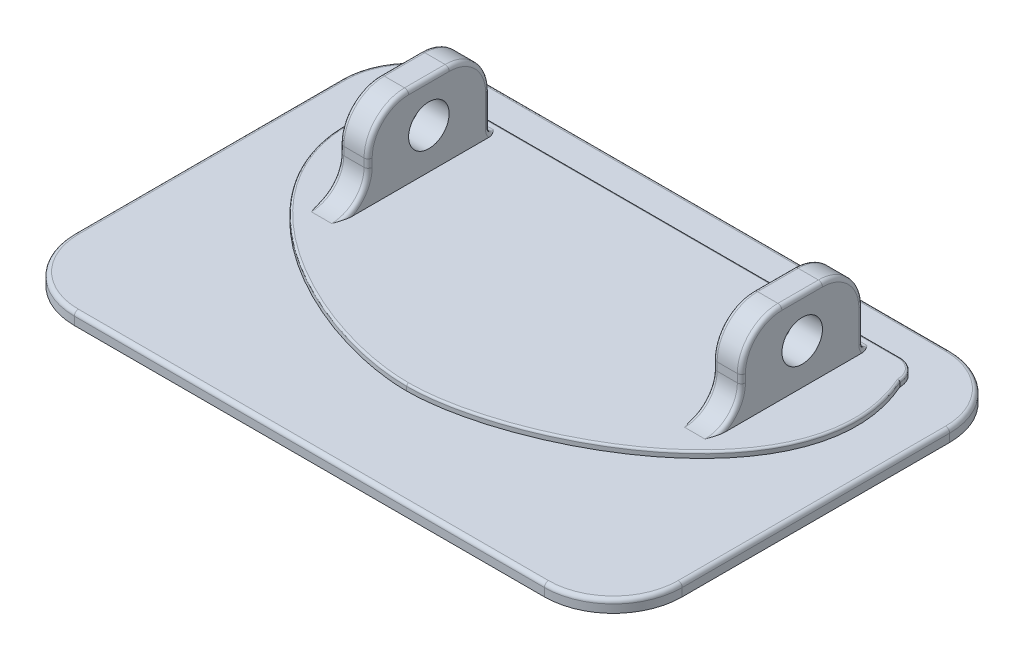
from build123d import *

# Parameters (mm, degrees)
SKETCH1_W               = 190.5
SKETCH1_H               = 127
BOSS_EXTRUDE1_DEPTH     = 7.62
FILLET1_R               = 43.18
FILLET2_R               = 2.54
BOSS_EXTRUDE7_DEPTH     = 3.81
FILLET3_R               = 1.27
SKETCH3_W               = 17.78
SKETCH3_H               = 76.2
BOSS_EXTRUDE8_DEPTH     = 50.8
CUT_EXTRUDE1_DEPTH      = 75.946
CUT_EXTRUDE1_DEPTH_BACK = 303.53
SKETCH4_R               = 12.7
FILLET4_R               = 25.4
FILLET5_R               = 20.32
FILLET6_R               = 5.08
FILLET7_R               = 2.54
SKETCH5_R               = 40
BOSS_EXTRUDE9_DEPTH     = 20


with BuildPart() as part:
    # Sketch1 → Boss-Extrude1 (new body)
    with BuildSketch(Plane(origin=(0, 0, 0), x_dir=(1, 0, 0), z_dir=(0, 1, 0))):
        with Locations((-95.25, 63.5)):
            Rectangle(SKETCH1_W, SKETCH1_H)
        with Locations((-95.25, -63.5)):
            Rectangle(SKETCH1_W, SKETCH1_H)
        with Locations((95.25, -63.5)):
            Rectangle(SKETCH1_W, SKETCH1_H)
        with Locations((95.25, 63.5)):
            Rectangle(SKETCH1_W, SKETCH1_H)
    extrude(amount=BOSS_EXTRUDE1_DEPTH)

    # Fillet1
    fillet1_edges = [part.edges().sort_by_distance(p)[0] for p in [
        (190.5, 3.81, -127),
        (190.5, 3.81, 127),
        (-190.5, 3.81, 127),
        (-190.5, 3.81, -127),
    ]]
    fillet(fillet1_edges, radius=FILLET1_R)

    # Fillet2
    fillet2_edges = [part.edges().sort_by_distance(p)[0] for p in [
        (-190.5, 7.62, 0),
        (0, 7.62, -127),
        (0, 7.62, 127),
        (190.5, 7.62, 0),
        (-177.852870812, 7.62, 114.352870812),
        (177.852870812, 7.62, 114.352870812),
        (177.852870812, 7.62, -114.352870812),
        (-177.852870812, 7.62, -114.352870812),
    ]]
    fillet(fillet2_edges, radius=FILLET2_R)

    # Boss-Extrude7: read off the stored shape, not the designer's step
    # Boss-Extrude7 outline → Boss-Extrude7 (add)
    with BuildSketch(Plane(origin=(0, 7.62, 0), x_dir=(1, 0, 0), z_dir=(0, 1, 0))):
        with BuildLine():
            add(Edge.make_bspline(
                [(152.4, 90.742820972), (192.421496029, 0.246614853), (67.037564927, -66.015914753), (0.035402358, -66.039993442)],
                knots=[0, 0, 0, 0, 0.861976712, 0.861976712, 0.861976712, 0.861976712], degree=3))
            ThreePointArc((152.4, 90.742820972), (148.680256121, 99.723077093), (139.7, 103.442820972))
            Line((139.7, 103.442820972), (-139.7, 103.442820972))
            ThreePointArc((-139.7, 103.442820972), (-148.680256121, 99.723077093), (-152.4, 90.742820972))
            add(Edge.make_bspline(
                [(-152.4, 90.742820972), (-192.428546796, 0.231099908), (-66.971286312, -66.051652702), (0.023603383, -66.039997951), (0.035402358, -66.039993442)],
                knots=[0, 0, 0, 0, 0.862128551, 0.862280437, 0.862280437, 0.862280437, 0.862280437], degree=3))
        make_face()
    extrude(amount=BOSS_EXTRUDE7_DEPTH)

    # Fillet3
    fillet3_edges = [part.edges().sort_by_distance(p)[0] for p in [
        (116.912058042, 11.43, 21.123611422),
        (0, 11.43, -103.442820972),
        (148.680256121, 11.43, -99.723077093),
        (-148.680256121, 11.43, -99.723077093),
        (-116.884695986, 11.43, 21.145875685),
    ]]
    fillet(fillet3_edges, radius=FILLET3_R)

    # Sketch3 → Boss-Extrude8 (add)
    with BuildSketch(Plane(origin=(0, 11.43, 0), x_dir=(1, 0, 0), z_dir=(0, 1, 0))):
        with Locations((116.997822191, 56.001627812)):
            Rectangle(SKETCH3_W, SKETCH3_H)
        with Locations((-116.997822191, 56.001627812)):
            Rectangle(SKETCH3_W, SKETCH3_H)
    extrude(amount=BOSS_EXTRUDE8_DEPTH)

    # Sketch4 → Cut-Extrude1 (cut, two sides: drawn at the far end of the back side and taken through both)
    with BuildSketch(Plane.ZY.offset(125.887822191).offset(-CUT_EXTRUDE1_DEPTH_BACK)):
        with Locations(Location((-56.001627812, 36.83, 0), (0, 0, 180))):
            Circle(SKETCH4_R)
    extrude(amount=CUT_EXTRUDE1_DEPTH + CUT_EXTRUDE1_DEPTH_BACK, mode=Mode.SUBTRACT)

    # Fillet4
    fillet4_edges = [part.edges().sort_by_distance(p)[0] for p in [
        (-116.997822191, 62.23, -94.101627812),
        (-116.997822191, 62.23, -17.901627812),
        (116.997822191, 62.23, -94.101627812),
        (116.997822191, 62.23, -17.901627812),
    ]]
    fillet(fillet4_edges, radius=FILLET4_R)

    # Fillet5
    fillet5_edges = [part.edges().sort_by_distance(p)[0] for p in [
        (-116.997822191, 11.43, -17.901627812),
        (116.997822191, 11.43, -17.901627812),
    ]]
    fillet(fillet5_edges, radius=FILLET5_R)

    # Fillet6
    fillet6_edges = [part.edges().sort_by_distance(p)[0] for p in [
        (-116.997822191, 11.43, -94.101627812),
        (116.997822191, 11.43, -94.101627812),
    ]]
    fillet(fillet6_edges, radius=FILLET6_R)

    # Fillet7
    # the kernel refuses this fillet: 2.54 mm, written as the material it takes off along each edge
    with BuildSketch(Plane(origin=(125.887822191, 62.23, -43.301627812), x_dir=(0, -1, 0), z_dir=(0, 0, -1)), Plane(origin=(108.107822191, 62.23, -68.701627812), x_dir=(0, -1, 0), z_dir=(0, 0, 1))) as fillet7_piece_1:
        with BuildLine():
            CenterArc((FILLET7_R, FILLET7_R), FILLET7_R, 180, 90)
            Line((0, FILLET7_R), (0, 0))
            Line((0, 0), (FILLET7_R, 0))
        make_face()
    extrude(amount=25.4, mode=Mode.SUBTRACT)
    with BuildSketch(Plane(origin=(108.107822191, 31.75, -17.901627812), x_dir=(0, 0, -1), z_dir=(0, 1, 0)), Plane(origin=(-108.107822191, 31.75, -17.901627812), x_dir=(-1, 0, 0), z_dir=(0, 1, 0))) as fillet7_piece_2:
        with BuildLine():
            CenterArc((FILLET7_R, -FILLET7_R), FILLET7_R, 90, 90)
            Line((0, -FILLET7_R), (0, 0))
            Line((0, 0), (FILLET7_R, 0))
        make_face()
    extrude(amount=5.08, mode=Mode.SUBTRACT)
    with BuildSketch(Plane(origin=(108.107822191, 16.51, -94.101627812), x_dir=(0, 0, 1), z_dir=(0, 1, 0)), Plane(origin=(-108.107822191, 16.51, -94.101627812), x_dir=(-1, 0, 0), z_dir=(0, 1, 0))) as fillet7_piece_3:
        with BuildLine():
            CenterArc((FILLET7_R, FILLET7_R), FILLET7_R, 180, 90)
            Line((0, FILLET7_R), (0, 0))
            Line((0, 0), (FILLET7_R, 0))
        make_face()
    extrude(amount=20.32, mode=Mode.SUBTRACT)
    with BuildSketch(Plane(origin=(108.107822191, 36.83, -43.301627812), x_dir=(0, 0, 1), z_dir=(0, -1, 0))) as fillet7_piece_4:
        with BuildLine():
            CenterArc((25.4 - FILLET7_R, -FILLET7_R), FILLET7_R, 0, 90)
            Line((25.4, -FILLET7_R), (25.4, 0))
            Line((25.4, 0), (25.4 - FILLET7_R, 0))
        make_face()
    revolve(axis=Axis((108.107822191, 36.83, -43.301627812), (-1, 0, 0)), revolution_arc=90, mode=Mode.SUBTRACT)
    with BuildSketch(Plane(origin=(108.107822191, 36.83, -68.701627812), x_dir=(0, 0, -1), z_dir=(0, -1, 0))) as fillet7_piece_5:
        with BuildLine():
            CenterArc((25.4 - FILLET7_R, FILLET7_R), FILLET7_R, 270, 90)
            Line((25.4, FILLET7_R), (25.4, 0))
            Line((25.4, 0), (25.4 - FILLET7_R, 0))
        make_face()
    revolve(axis=Axis((108.107822191, 36.83, -68.701627812), (1, 0, 0)), revolution_arc=90, mode=Mode.SUBTRACT)
    with BuildSketch(Plane(origin=(125.887822191, 16.51, -94.101627812), x_dir=(0, 0, 1), z_dir=(0, 1, 0)), Plane(origin=(-125.887822191, 16.51, -94.101627812), x_dir=(1, 0, 0), z_dir=(0, 1, 0))) as fillet7_piece_6:
        with BuildLine():
            CenterArc((FILLET7_R, -FILLET7_R), FILLET7_R, 90, 90)
            Line((0, -FILLET7_R), (0, 0))
            Line((0, 0), (FILLET7_R, 0))
        make_face()
    extrude(amount=20.32, mode=Mode.SUBTRACT)
    with BuildSketch(Plane(origin=(125.887822191, 31.75, -17.901627812), x_dir=(0, 0, -1), z_dir=(0, 1, 0)), Plane(origin=(-125.887822191, 31.75, -17.901627812), x_dir=(1, 0, 0), z_dir=(0, 1, 0))) as fillet7_piece_7:
        with BuildLine():
            CenterArc((FILLET7_R, FILLET7_R), FILLET7_R, 180, 90)
            Line((0, FILLET7_R), (0, 0))
            Line((0, 0), (FILLET7_R, 0))
        make_face()
    extrude(amount=5.08, mode=Mode.SUBTRACT)
    with BuildSketch(Plane(origin=(125.887822191, 36.83, -43.301627812), x_dir=(0, 0, 1), z_dir=(0, -1, 0))) as fillet7_piece_8:
        with BuildLine():
            CenterArc((25.4 - FILLET7_R, FILLET7_R), FILLET7_R, 270, 90)
            Line((25.4, FILLET7_R), (25.4, 0))
            Line((25.4, 0), (25.4 - FILLET7_R, 0))
        make_face()
    revolve(axis=Axis((125.887822191, 36.83, -43.301627812), (-1, 0, 0)), revolution_arc=90, mode=Mode.SUBTRACT)
    with BuildSketch(Plane(origin=(125.887822191, 36.83, -68.701627812), x_dir=(0, 0, -1), z_dir=(0, -1, 0))) as fillet7_piece_9:
        with BuildLine():
            CenterArc((25.4 - FILLET7_R, -FILLET7_R), FILLET7_R, 0, 90)
            Line((25.4, -FILLET7_R), (25.4, 0))
            Line((25.4, 0), (25.4 - FILLET7_R, 0))
        make_face()
    revolve(axis=Axis((125.887822191, 36.83, -68.701627812), (1, 0, 0)), revolution_arc=90, mode=Mode.SUBTRACT)
    with BuildSketch(Plane(origin=(-108.107822191, 62.23, -43.301627812), x_dir=(-1, 0, 0), z_dir=(0, 0, -1)), Plane(origin=(-125.887822191, 62.23, -68.701627812), x_dir=(1, 0, 0), z_dir=(0, 0, 1))) as fillet7_piece_10:
        with BuildLine():
            CenterArc((FILLET7_R, -FILLET7_R), FILLET7_R, 90, 90)
            Line((0, -FILLET7_R), (0, 0))
            Line((0, 0), (FILLET7_R, 0))
        make_face()
    extrude(amount=25.4, mode=Mode.SUBTRACT)
    with BuildSketch(Plane(origin=(-125.887822191, 36.83, -43.301627812), x_dir=(0, 0, 1), z_dir=(0, -1, 0))) as fillet7_piece_11:
        with BuildLine():
            CenterArc((25.4 - FILLET7_R, -FILLET7_R), FILLET7_R, 0, 90)
            Line((25.4 - FILLET7_R, 0), (25.4, 0))
            Line((25.4, 0), (25.4, -FILLET7_R))
        make_face()
    revolve(axis=Axis((-125.887822191, 36.83, -43.301627812), (-1, 0, 0)), revolution_arc=90, mode=Mode.SUBTRACT)
    with BuildSketch(Plane(origin=(-125.887822191, 36.83, -68.701627812), x_dir=(0, 0, -1), z_dir=(0, -1, 0))) as fillet7_piece_12:
        with BuildLine():
            CenterArc((25.4 - FILLET7_R, FILLET7_R), FILLET7_R, 270, 90)
            Line((25.4 - FILLET7_R, 0), (25.4, 0))
            Line((25.4, 0), (25.4, FILLET7_R))
        make_face()
    revolve(axis=Axis((-125.887822191, 36.83, -68.701627812), (1, 0, 0)), revolution_arc=90, mode=Mode.SUBTRACT)
    with BuildSketch(Plane(origin=(-108.107822191, 36.83, -43.301627812), x_dir=(0, 0, 1), z_dir=(0, -1, 0))) as fillet7_piece_13:
        with BuildLine():
            CenterArc((25.4 - FILLET7_R, FILLET7_R), FILLET7_R, 270, 90)
            Line((25.4 - FILLET7_R, 0), (25.4, 0))
            Line((25.4, 0), (25.4, FILLET7_R))
        make_face()
    revolve(axis=Axis((-108.107822191, 36.83, -43.301627812), (-1, 0, 0)), revolution_arc=90, mode=Mode.SUBTRACT)
    with BuildSketch(Plane(origin=(-108.107822191, 36.83, -68.701627812), x_dir=(0, 0, -1), z_dir=(0, -1, 0))) as fillet7_piece_14:
        with BuildLine():
            CenterArc((25.4 - FILLET7_R, -FILLET7_R), FILLET7_R, 0, 90)
            Line((25.4 - FILLET7_R, 0), (25.4, 0))
            Line((25.4, 0), (25.4, -FILLET7_R))
        make_face()
    revolve(axis=Axis((-108.107822191, 36.83, -68.701627812), (1, 0, 0)), revolution_arc=90, mode=Mode.SUBTRACT)
    with BuildSketch(Plane(origin=(125.887822191, 31.75, 2.418372188), x_dir=(0, 0, -1), z_dir=(0, 1, 0))) as fillet7_piece_15_section:
        with BuildLine():
            CenterArc((20.32 + FILLET7_R, FILLET7_R), FILLET7_R, 180, 90)
            Line((20.32, FILLET7_R), (20.32, 0))
            Line((20.32, 0), (20.32 + FILLET7_R, 0))
        make_face()
    fillet7_piece_15 = revolve(axis=Axis((125.887822191, 31.75, 2.418372188), (-1, 0, 0)), revolution_arc=120.450610213, mode=Mode.PRIVATE)
    fillet7_piece_15 = split(fillet7_piece_15, bisect_by=Plane(origin=(125.887822191, 11.43, 2.418372188), z_dir=(0, 1, 0)), keep=Keep.TOP, mode=Mode.PRIVATE)
    add(fillet7_piece_15, mode=Mode.SUBTRACT)
    with BuildSketch(Plane(origin=(108.107822191, 31.75, 2.418372188), x_dir=(0, 0, -1), z_dir=(0, 1, 0))) as fillet7_piece_16_section:
        with BuildLine():
            CenterArc((20.32 + FILLET7_R, -FILLET7_R), FILLET7_R, 90, 90)
            Line((20.32, -FILLET7_R), (20.32, 0))
            Line((20.32, 0), (20.32 + FILLET7_R, 0))
        make_face()
    fillet7_piece_16 = revolve(axis=Axis((108.107822191, 31.75, 2.418372188), (-1, 0, 0)), revolution_arc=120.450610213, mode=Mode.PRIVATE)
    fillet7_piece_16 = split(fillet7_piece_16, bisect_by=Plane(origin=(108.107822191, 11.43, 2.418372188), z_dir=(0, 1, 0)), keep=Keep.TOP, mode=Mode.PRIVATE)
    add(fillet7_piece_16, mode=Mode.SUBTRACT)
    with BuildSketch(Plane(origin=(-108.107822191, 31.75, 2.418372188), x_dir=(0, -0.8620663456403814, 0.506795437740158), z_dir=(0, 0.506795437740158, 0.8620663456403814))) as fillet7_piece_17_section:
        with BuildLine():
            CenterArc((20.32 + FILLET7_R, -FILLET7_R), FILLET7_R, 90, 90)
            Line((20.32 + FILLET7_R, 0), (20.32, 0))
            Line((20.32, 0), (20.32, -FILLET7_R))
        make_face()
    fillet7_piece_17 = revolve(axis=Axis((-108.107822191, 31.75, 2.418372188), (1, 0, 0)), revolution_arc=120.450610213, mode=Mode.PRIVATE)
    fillet7_piece_17 = split(fillet7_piece_17, bisect_by=Plane(origin=(-108.107822191, 11.43, 2.418372188), z_dir=(0, 1, 0)), keep=Keep.TOP, mode=Mode.PRIVATE)
    add(fillet7_piece_17, mode=Mode.SUBTRACT)
    with BuildSketch(Plane(origin=(-125.887822191, 31.75, 2.418372188), x_dir=(0, -0.8620663456403814, 0.5067954377401582), z_dir=(0, 0.5067954377401582, 0.8620663456403814))) as fillet7_piece_18_section:
        with BuildLine():
            CenterArc((20.32 + FILLET7_R, FILLET7_R), FILLET7_R, 180, 90)
            Line((20.32 + FILLET7_R, 0), (20.32, 0))
            Line((20.32, 0), (20.32, FILLET7_R))
        make_face()
    fillet7_piece_18 = revolve(axis=Axis((-125.887822191, 31.75, 2.418372188), (1, 0, 0)), revolution_arc=120.450610213, mode=Mode.PRIVATE)
    fillet7_piece_18 = split(fillet7_piece_18, bisect_by=Plane(origin=(-125.887822191, 11.43, 2.418372188), z_dir=(0, 1, 0)), keep=Keep.TOP, mode=Mode.PRIVATE)
    add(fillet7_piece_18, mode=Mode.SUBTRACT)
    with BuildSketch(Plane(origin=(-125.887822191, 16.51, -99.181627812), x_dir=(0, -0.3148458040869758, -0.9491428341660835), z_dir=(0, 0.9491428341660835, -0.3148458040869758))) as fillet7_piece_19_section:
        with BuildLine():
            CenterArc((5.08 + FILLET7_R, -FILLET7_R), FILLET7_R, 90, 90)
            Line((5.08, -FILLET7_R), (5.08, 0))
            Line((5.08, 0), (5.08 + FILLET7_R, 0))
        make_face()
    fillet7_piece_19 = revolve(axis=Axis((-125.887822191, 16.51, -99.181627812), (-1, 0, 0)), revolution_arc=161.648494619, mode=Mode.PRIVATE)
    fillet7_piece_19 = split(fillet7_piece_19, bisect_by=Plane(origin=(-125.887822191, 11.43, -99.181627812), z_dir=(0, 1, 0)), keep=Keep.TOP, mode=Mode.PRIVATE)
    add(fillet7_piece_19, mode=Mode.SUBTRACT)
    with BuildSketch(Plane(origin=(-108.107822191, 16.51, -99.181627812), x_dir=(0, -0.3148458040869758, -0.9491428341660835), z_dir=(0, 0.9491428341660835, -0.3148458040869758))) as fillet7_piece_20_section:
        with BuildLine():
            CenterArc((5.08 + FILLET7_R, FILLET7_R), FILLET7_R, 180, 90)
            Line((5.08 + FILLET7_R, 0), (5.08, 0))
            Line((5.08, 0), (5.08, FILLET7_R))
        make_face()
    fillet7_piece_20 = revolve(axis=Axis((-108.107822191, 16.51, -99.181627812), (-1, 0, 0)), revolution_arc=161.648494619, mode=Mode.PRIVATE)
    fillet7_piece_20 = split(fillet7_piece_20, bisect_by=Plane(origin=(-108.107822191, 11.43, -99.181627812), z_dir=(0, 1, 0)), keep=Keep.TOP, mode=Mode.PRIVATE)
    add(fillet7_piece_20, mode=Mode.SUBTRACT)
    with BuildSketch(Plane(origin=(108.107822191, 16.51, -99.181627812), x_dir=(2.797412345512208e-15, -0.3148458040869749, -0.9491428341660838), z_dir=(1.0065754734692808e-15, 0.9491428341660838, -0.3148458040869749))) as fillet7_piece_21_section:
        with BuildLine():
            CenterArc((5.08 + FILLET7_R, -FILLET7_R), FILLET7_R, 90, 90)
            Line((5.08, -FILLET7_R), (5.08, 0))
            Line((5.08, 0), (5.08 + FILLET7_R, 0))
        make_face()
    fillet7_piece_21 = revolve(axis=Axis((108.107822191, 16.51, -99.181627812), (-1, 0, 0)), revolution_arc=161.648494619, mode=Mode.PRIVATE)
    fillet7_piece_21 = split(fillet7_piece_21, bisect_by=Plane(origin=(108.107822191, 11.43, -99.181627812), z_dir=(0, 1, 0)), keep=Keep.TOP, mode=Mode.PRIVATE)
    add(fillet7_piece_21, mode=Mode.SUBTRACT)
    with BuildSketch(Plane(origin=(125.887822191, 16.51, -99.181627812), x_dir=(2.7974123455122068e-15, -0.3148458040869758, -0.9491428341660835), z_dir=(1.0065754734692838e-15, 0.9491428341660835, -0.3148458040869758))) as fillet7_piece_22_section:
        with BuildLine():
            CenterArc((5.08 + FILLET7_R, FILLET7_R), FILLET7_R, 180, 90)
            Line((5.08, FILLET7_R), (5.08, 0))
            Line((5.08, 0), (5.08 + FILLET7_R, 0))
        make_face()
    fillet7_piece_22 = revolve(axis=Axis((125.887822191, 16.51, -99.181627812), (-1, 0, 0)), revolution_arc=161.648494619, mode=Mode.PRIVATE)
    fillet7_piece_22 = split(fillet7_piece_22, bisect_by=Plane(origin=(125.887822191, 11.43, -99.181627812), z_dir=(0, 1, 0)), keep=Keep.TOP, mode=Mode.PRIVATE)
    add(fillet7_piece_22, mode=Mode.SUBTRACT)

    # Sketch5 → Boss-Extrude9 (add)
    with BuildSketch(Plane.XZ):
        with Locations(Location((0, 0, 0), (0, 0, 270))):
            Circle(SKETCH5_R)
    extrude(amount=BOSS_EXTRUDE9_DEPTH)


solid = part.part
